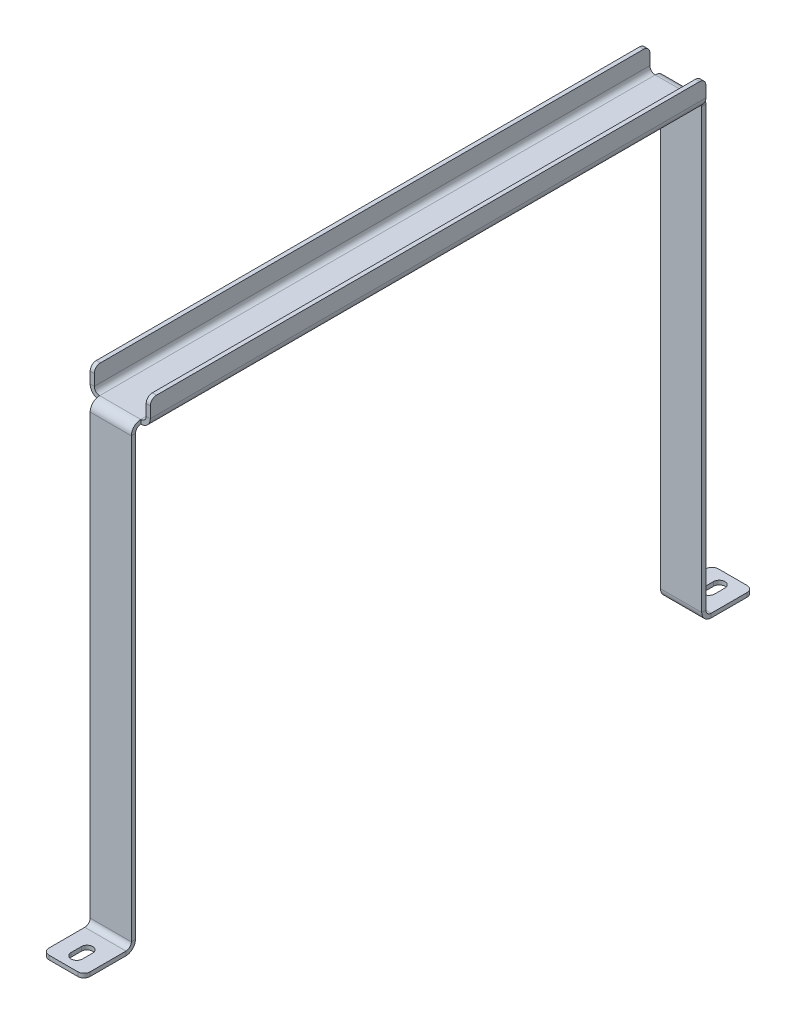
from build123d import *

# Parameters (mm, degrees)
ODGI_CIE_BAZOWE1_DEPTH        = 10
ODGI_CIE_KRAW_DZI1_DEPTH      = 269.8
ODGI_CIE_KRAW_DZI1_BEND_DEPTH = 269.8
SZCZELINA_START               = -220
SZCZELINA_POD_RUB_M51_DEPTH   = 2
ZAOKR_GLENIE1_R               = 3


# Read off the part's stored shape, not the designer's step: Szczelina pod śrubę M51
# Sheet-metal steps are written as plain solids
with BuildPart() as part:
    # Szkic1 → Odgięcie bazowe1 (new, symmetric)
    with BuildSketch(Plane(origin=(0, 0, 0), x_dir=(0, 0, -1), z_dir=(1, 0, 0))):
        with BuildLine():
            Line((-162.5, -220), (-142.1, -220))
            ThreePointArc((-142.1, -220), (-138.847308807, -218.652691193), (-137.5, -215.4))
            Line((-137.5, -215.4), (-137.5, -2.6))
            ThreePointArc((-137.5, -2.6), (-136.738477631, -0.761522369), (-134.9, 0))
            Line((-134.9, 0), (134.9, 0))
            ThreePointArc((134.9, 0), (136.738477631, -0.761522369), (137.5, -2.6))
            Line((137.5, -2.6), (137.5, -215.4))
            ThreePointArc((137.5, -215.4), (138.847308807, -218.652691193), (142.1, -220))
            Line((142.1, -220), (162.5, -220))
            Line((162.5, -220), (162.5, -218))
            Line((162.5, -218), (142.1, -218))
            ThreePointArc((142.1, -218), (140.261522369, -217.238477631), (139.5, -215.4))
            Line((139.5, -215.4), (139.5, -2.6))
            ThreePointArc((139.5, -2.6), (138.152691193, 0.652691193), (134.9, 2))
            Line((134.9, 2), (-134.9, 2))
            ThreePointArc((-134.9, 2), (-138.152691193, 0.652691193), (-139.5, -2.6))
            Line((-139.5, -2.6), (-139.5, -215.4))
            ThreePointArc((-139.5, -215.4), (-140.261522369, -217.238477631), (-142.1, -218))
            Line((-142.1, -218), (-162.5, -218))
            Line((-162.5, -218), (-162.5, -220))
        make_face()
    extrude(amount=ODGI_CIE_BAZOWE1_DEPTH, both=True)

    # Odgięcie krawędzi1 section (across the edge) → Odgięcie krawędzi1 (add)
    with BuildSketch(Plane(origin=(12.6, 2, 134.9), x_dir=(-1, 0, 0), z_dir=(0, 0, -1))):
        with BuildLine():
            Line((-2, 2.6), (-2, 11))
            Line((-2, 11), (0, 11))
            Line((0, 11), (0, 2.6))
            ThreePointArc((0, 2.6), (0.761522369, 0.761522369), (2.6, 0))
            Line((2.6, 0), (2.6, -2))
            ThreePointArc((2.6, -2), (-0.652691193, -0.652691193), (-2, 2.6))
        make_face()
    extrude(amount=ODGI_CIE_KRAW_DZI1_DEPTH)

    # Odgięcie krawędzi1 section 2 (across the edge) → Odgięcie krawędzi1 bend (add)
    with BuildSketch(Plane(origin=(-12.6, 2, -134.9), x_dir=(1, 0, 0), z_dir=(0, 0, 1))):
        with BuildLine():
            Line((-2, 2.6), (-2, 11))
            Line((-2, 11), (0, 11))
            Line((0, 11), (0, 2.6))
            ThreePointArc((0, 2.6), (0.761522369, 0.761522369), (2.6, 0))
            Line((2.6, 0), (2.6, -2))
            ThreePointArc((2.6, -2), (-0.652691193, -0.652691193), (-2, 2.6))
        make_face()
    extrude(amount=ODGI_CIE_KRAW_DZI1_BEND_DEPTH)

    # Szczelina pod śrubę M51 outline → Szczelina pod śrubę M51 (cut)
    with BuildSketch(Plane(origin=(0, 0, 0), x_dir=(1, 0, 0), z_dir=(0, 1, 0)).offset(SZCZELINA_START)):
        with BuildLine():
            Line((2.75, 151), (2.75, 156))
            ThreePointArc((2.75, 156), (0, 158.75), (-2.75, 156))
            Line((-2.75, 156), (-2.75, 151))
            ThreePointArc((-2.75, 151), (0, 148.25), (2.75, 151))
        make_face()
        with BuildLine():
            ThreePointArc((2.75, -151), (0, -148.25), (-2.75, -151))
            Line((-2.75, -151), (-2.75, -156))
            ThreePointArc((-2.75, -156), (0, -158.75), (2.75, -156))
            Line((2.75, -156), (2.75, -151))
        make_face()
    extrude(amount=SZCZELINA_POD_RUB_M51_DEPTH, mode=Mode.SUBTRACT)

    # Zaokrąglenie1
    zaokr_glenie1_edges = [part.edges().sort_by_distance(p)[0] for p in [
        (-13.6, 13, 134.9),
        (-10, -219, -162.5),
        (-10, -219, 162.5),
        (10, -219, -162.5),
        (13.6, 13, 134.9),
        (13.6, 13, -134.9),
        (10, -219, 162.5),
        (-13.6, 13, -134.9),
    ]]
    fillet(zaokr_glenie1_edges, radius=ZAOKR_GLENIE1_R)


solid = part.part
